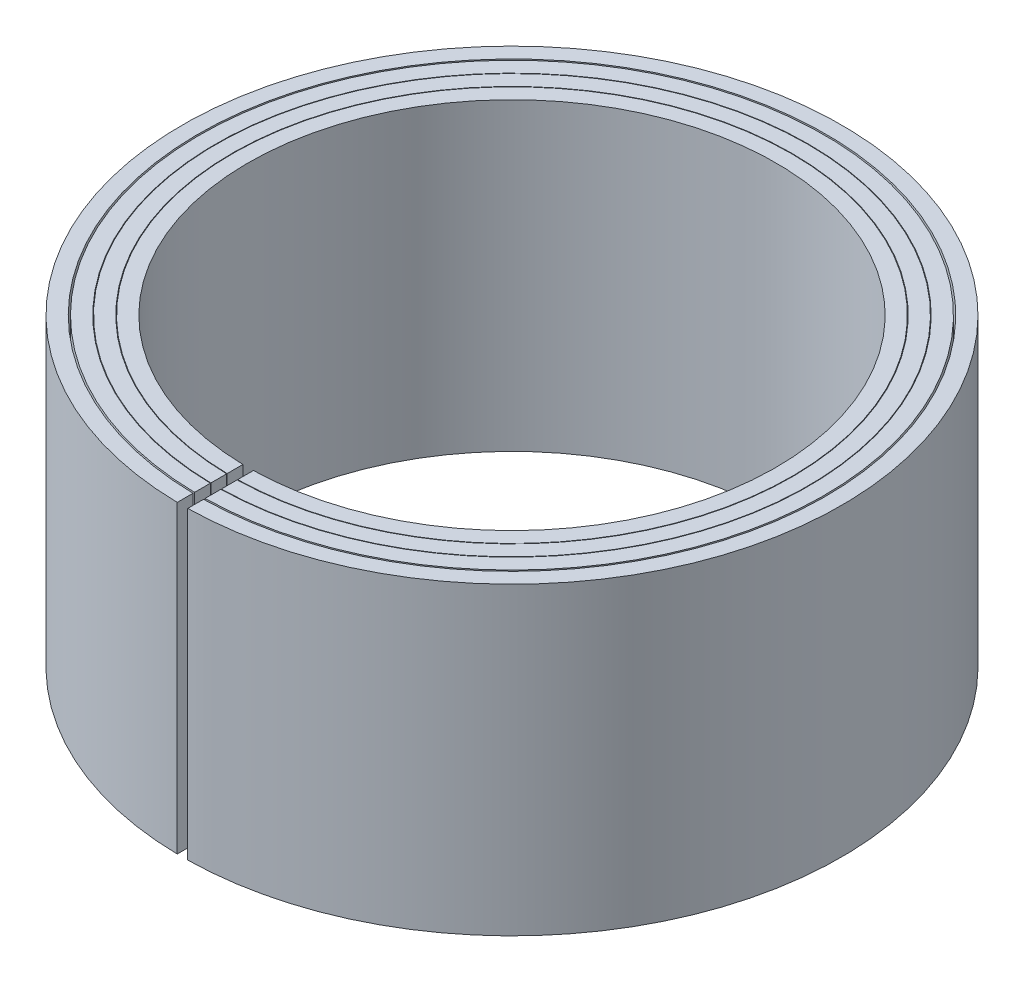
from build123d import *

# Parameters (mm, degrees)
BOSS_EXTRUDE1_OUTLINE_R   = 796.925
BOSS_EXTRUDE1_OUTLINE_R_2 = 758.825
BOSS_EXTRUDE1_DEPTH       = 914.4
SKETCH3_R                 = 676.275
SKETCH3_R_2               = 638.175
BOSS_EXTRUDE2_DEPTH       = 736.6
SKETCH3_R_3               = 715.645
SKETCH3_R_4               = 677.545
BOSS_EXTRUDE2_2_DEPTH     = 736.6
SKETCH3_R_5               = 755.015
SKETCH3_R_6               = 716.915
BOSS_EXTRUDE2_3_DEPTH     = 736.6
SKETCH2_W                 = 25.4
SKETCH2_H                 = 508
CUT_EXTRUDE2_DEPTH        = 1452.311913839
CUT_EXTRUDE3_DEPTH        = 177.8


# Read off the part's stored shape, not the designer's step: Boss-Extrude1
with BuildPart() as part:
    # Boss-Extrude1 outline → Boss-Extrude1 (new body)
    with BuildSketch(Plane(origin=(0, 0, 0), x_dir=(1, 0, 0), z_dir=(0, 1, 0))):
        Circle(BOSS_EXTRUDE1_OUTLINE_R)
        Circle(BOSS_EXTRUDE1_OUTLINE_R_2, mode=Mode.SUBTRACT)
    extrude(amount=BOSS_EXTRUDE1_DEPTH)


with BuildPart() as body_2:
    # Sketch3 → Boss-Extrude2 (new body)
    with BuildSketch(Plane(origin=(0, 914.4, 0), x_dir=(1, 0, 0), z_dir=(0, 1, 0))):
        with Locations(Location((0, 0, 0), (0, 0, 270))):
            Circle(SKETCH3_R)
        with Locations(Location((0, 0, 0), (0, 0, 270))):
            Circle(SKETCH3_R_2, mode=Mode.SUBTRACT)
    extrude(amount=-BOSS_EXTRUDE2_DEPTH)


with BuildPart() as body_3:
    # Sketch3 → Boss-Extrude2 2 (new body)
    with BuildSketch(Plane(origin=(0, 914.4, 0), x_dir=(1, 0, 0), z_dir=(0, 1, 0))):
        with Locations(Location((0, 0, 0), (0, 0, 270))):
            Circle(SKETCH3_R_3)
        with Locations(Location((0, 0, 0), (0, 0, 270))):
            Circle(SKETCH3_R_4, mode=Mode.SUBTRACT)
    extrude(amount=-BOSS_EXTRUDE2_2_DEPTH)


with BuildPart() as body_4:
    # Sketch3 → Boss-Extrude2 3 (new body)
    with BuildSketch(Plane(origin=(0, 914.4, 0), x_dir=(1, 0, 0), z_dir=(0, 1, 0))):
        with Locations(Location((0, 0, 0), (0, 0, 270))):
            Circle(SKETCH3_R_5)
        with Locations(Location((0, 0, 0), (0, 0, 270))):
            Circle(SKETCH3_R_6, mode=Mode.SUBTRACT)
    extrude(amount=-BOSS_EXTRUDE2_3_DEPTH)


with BuildPart() as cut_extrude2_tool:
    # Sketch2 → Cut-Extrude2 (new, through all)
    with BuildSketch(Plane(origin=(0, 0, 0), x_dir=(1, 0, 0), z_dir=(0, 1, 0))):
        with Locations((0, -796.925)):
            Rectangle(SKETCH2_W, SKETCH2_H)
    extrude(amount=CUT_EXTRUDE2_DEPTH)


with BuildPart() as part_1:
    add(part.part)

    # Cut-Extrude2: cut by cut_extrude2_tool
    add(cut_extrude2_tool.part, mode=Mode.SUBTRACT)

    # Sketch4 → Cut-Extrude3 (cut)
    with BuildSketch(Plane.XZ):
        with BuildLine():
            Line((12.7, 796.823798355), (12.7, 758.718716406))
            ThreePointArc((12.7, 758.718716406), (0, -758.825), (-12.7, 758.718716406))
            Line((-12.7, 758.718716406), (-12.7, 796.823798355))
            ThreePointArc((-12.7, 796.823798355), (0, -796.925), (12.7, 796.823798355))
        make_face()
    extrude(amount=-CUT_EXTRUDE3_DEPTH, mode=Mode.SUBTRACT)


with BuildPart() as body_2_1:
    add(body_2.part)

    # Cut-Extrude2: cut by cut_extrude2_tool
    add(cut_extrude2_tool.part, mode=Mode.SUBTRACT)


with BuildPart() as body_3_1:
    add(body_3.part)

    # Cut-Extrude2: cut by cut_extrude2_tool
    add(cut_extrude2_tool.part, mode=Mode.SUBTRACT)


with BuildPart() as body_4_1:
    add(body_4.part)

    # Cut-Extrude2: cut by cut_extrude2_tool
    add(cut_extrude2_tool.part, mode=Mode.SUBTRACT)


solid = Compound([part_1.part, body_2_1.part, body_3_1.part, body_4_1.part])
